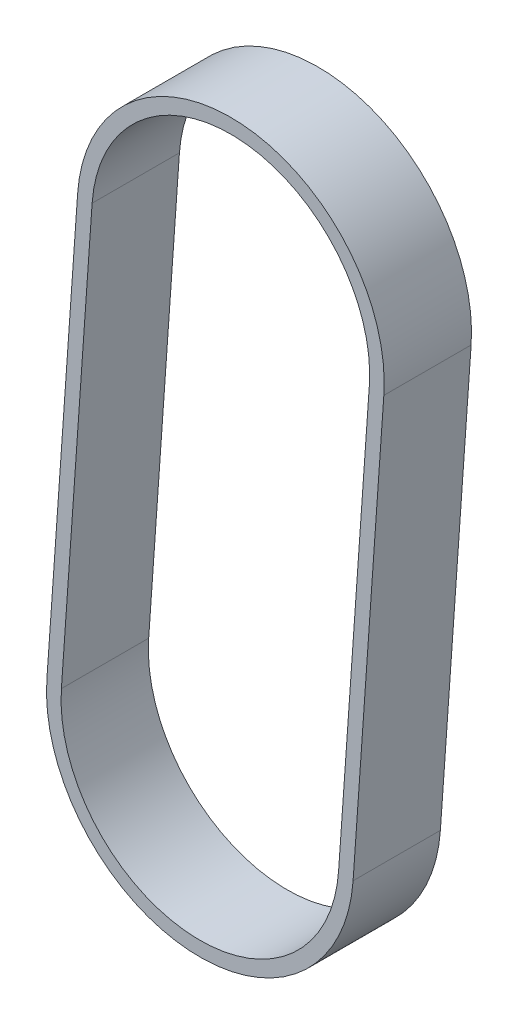
from build123d import *

# Parameters (mm, degrees)
EXTRUDE_THIN1_DEPTH = 9


with BuildPart() as part:
    # Sketch2 → Extrude-Thin1 (new body)
    with BuildSketch(Plane.XY):
        with BuildLine():
            Line((15.784715598, -1.113546136), (12.615790494, -46.033626126))
            ThreePointArc((12.615790494, -46.033626126), (-4.282471243, -60.704795589), (-18.953640706, -43.806533852))
            Line((-18.953640706, -43.806533852), (-15.784715598, 1.113546138))
            ThreePointArc((-15.784715598, 1.113546138), (1.113546137, 15.784715599), (15.784715598, -1.113546137))
        make_face()
        with BuildLine():
            Line((14.288434261, -1.007989702), (11.119509157, -45.928069691))
            ThreePointArc((11.119509157, -45.928069691), (-4.176914808, -59.208514253), (-17.457359369, -43.912090287))
            Line((-17.457359369, -43.912090287), (-14.288434261, 1.007989703))
            ThreePointArc((-14.288434261, 1.007989703), (1.007989702, 14.288434262), (14.288434261, -1.007989702))
        make_face(mode=Mode.SUBTRACT)
    extrude(amount=EXTRUDE_THIN1_DEPTH)


solid = part.part
